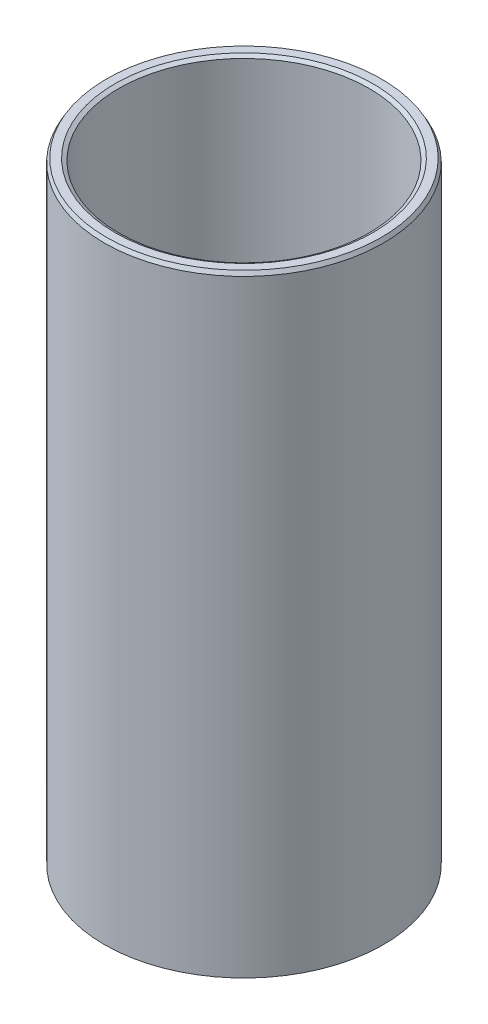
from build123d import *
from OCP.BRepFilletAPI import BRepFilletAPI_MakeChamfer

# Parameters (mm, degrees)
SKETCH1_R           = 50
BOSS_EXTRUDE1_DEPTH = 219.863733628
SKETCH2_R           = 44.865263197
CUT_EXTRUDE1_DEPTH  = 231.954673832
CHAMFER1_SIZE       = 1.355905983
CHAMFER1_SIZE2      = 0.782832684


with BuildPart() as part:
    # Sketch1 → Boss-Extrude1 (new body)
    with BuildSketch(Plane(origin=(0, 0, 0), x_dir=(1, 0, 0), z_dir=(0, 1, 0))):
        Circle(SKETCH1_R)
    extrude(amount=BOSS_EXTRUDE1_DEPTH)

    # Sketch2 → Cut-Extrude1 (cut, through all)
    with BuildSketch(Plane(origin=(0, 0, 0), x_dir=(1, 0, 0), z_dir=(0, 1, 0))):
        Circle(SKETCH2_R)
    extrude(amount=CUT_EXTRUDE1_DEPTH, mode=Mode.SUBTRACT)

    # Chamfer1: one chamfer whose edges measure the first distance from different faces: ONE call of the kernel's chamfer builder (chamfer() names one face for all edges)
    chamfer1_edges_1 = [part.edges().sort_by_distance(p)[0] for p in [
        (-44.865263197, 219.863733628, 0),
    ]]
    chamfer1_side_1 = [part.faces().sort_by_distance(p)[0] for p in [
        (-48.585786438, 219.863733628, 0),
    ]]
    chamfer1_edges_2 = [part.edges().sort_by_distance(p)[0] for p in [
        (-44.865263197, 0, 0),
    ]]
    chamfer1_side_2 = [part.faces().sort_by_distance(p)[0] for p in [
        (-44.865263197, 109.931866814, 0),
    ]]
    chamfer1_edges_3 = [part.edges().sort_by_distance(p)[0] for p in [
        (-50, 0, 0),
    ]]
    chamfer1_side_3 = [part.faces().sort_by_distance(p)[0] for p in [
        (-48.585786438, 0, 0),
    ]]
    chamfer1_edges_4 = [part.edges().sort_by_distance(p)[0] for p in [
        (-50, 219.863733628, 0),
    ]]
    chamfer1_side_4 = [part.faces().sort_by_distance(p)[0] for p in [
        (-50, 109.931866814, 0),
    ]]
    chamfer1 = BRepFilletAPI_MakeChamfer(part.part.solid().wrapped)
    for e in chamfer1_edges_1:
        chamfer1.Add(CHAMFER1_SIZE, CHAMFER1_SIZE2, e.wrapped, chamfer1_side_1[0].wrapped)  # the first distance lies on this face
    for e in chamfer1_edges_2:
        chamfer1.Add(CHAMFER1_SIZE, CHAMFER1_SIZE2, e.wrapped, chamfer1_side_2[0].wrapped)  # the first distance lies on this face
    for e in chamfer1_edges_3:
        chamfer1.Add(CHAMFER1_SIZE, CHAMFER1_SIZE2, e.wrapped, chamfer1_side_3[0].wrapped)  # the first distance lies on this face
    for e in chamfer1_edges_4:
        chamfer1.Add(CHAMFER1_SIZE, CHAMFER1_SIZE2, e.wrapped, chamfer1_side_4[0].wrapped)  # the first distance lies on this face
    add(Compound.cast(chamfer1.Shape()), mode=Mode.REPLACE)


solid = part.part
